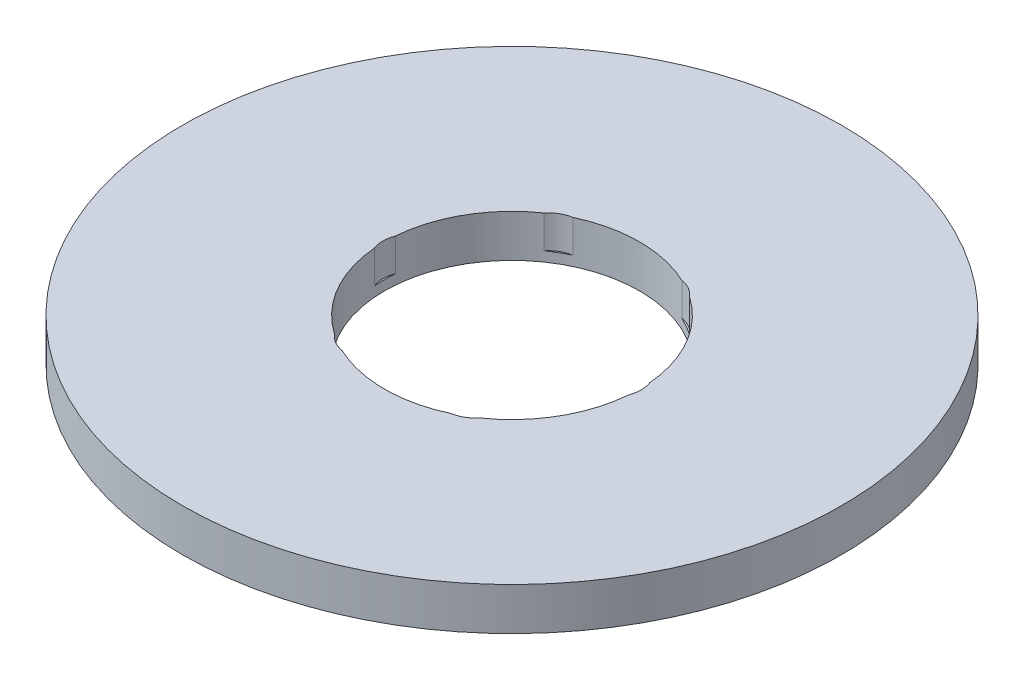
from build123d import *

# Parameters (mm, degrees)
SKETCH1_R           = 77.5
BOSS_EXTRUDE1_DEPTH = 10
SKETCH2_R           = 30
CUT_EXTRUDE1_DEPTH  = 111.056803515
SKETCH3_R           = 7.052265752
CUT_EXTRUDE2_DEPTH  = 7.705540898
CIRPATTERN1_COUNT   = 6


with BuildPart() as part:
    # Sketch1 → Boss-Extrude1 (new body)
    with BuildSketch(Plane(origin=(0, 0, 0), x_dir=(1, 0, 0), z_dir=(0, 1, 0))):
        Circle(SKETCH1_R)
    extrude(amount=BOSS_EXTRUDE1_DEPTH)

    # Sketch2 → Cut-Extrude1 (cut, through all)
    with BuildSketch(Plane(origin=(0, 0, 0), x_dir=(1, 0, 0), z_dir=(0, 1, 0))):
        Circle(SKETCH2_R)
    extrude(amount=CUT_EXTRUDE1_DEPTH, mode=Mode.SUBTRACT)

    # Sketch3 → Cut-Extrude2 (cut)
    with BuildSketch(Plane(origin=(0, 10, 0), x_dir=(1, 0, 0), z_dir=(0, 1, 0))):
        with Locations((-23.300240119, 0)):
            Circle(SKETCH3_R)
    cut_extrude2 = extrude(amount=-CUT_EXTRUDE2_DEPTH, mode=Mode.SUBTRACT)

    # CirPattern1: Cut-Extrude2 ×6 about axis
    cirpattern1_axis = Axis((0, 0, 0), (0, 1, 0))
    for i in range(1, CIRPATTERN1_COUNT):
        add(cut_extrude2.rotate(cirpattern1_axis, i * 360 / CIRPATTERN1_COUNT), mode=Mode.SUBTRACT)


solid = part.part
